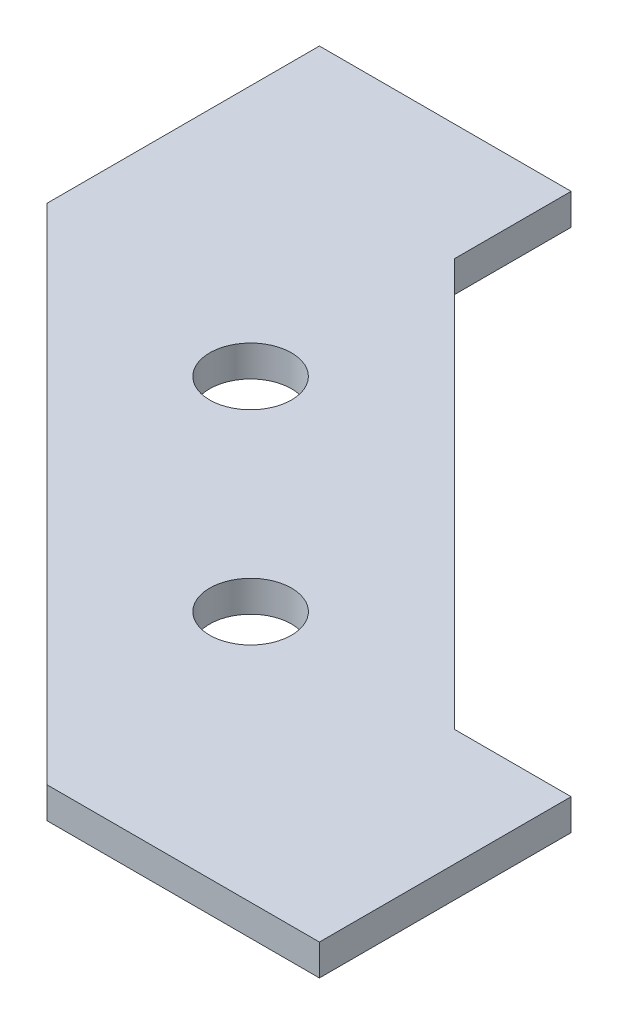
from build123d import *

# Parameters (mm, degrees)
SKETCH_1_R             = 5.25
SM_BASE_FLANGE_1_DEPTH = 4


# Sheet-metal steps are written as plain solids
with BuildPart() as part:
    # Sketch 1 → Базовая кромка1 (new body)
    with BuildSketch(Plane(origin=(0, 0, 0), x_dir=(1, 0, 0), z_dir=(0, 1, 0))):
        Polygon((39.244426356, -13.081475452), (-13.081475452, 39.244426356), (-13.081475452, 54.244426356), (-45.40737726, 54.244426356), (-45.40737726, 19.244426356), (19.244426356, -45.40737726), (54.244426356, -45.40737726), (54.244426356, -13.081475452), align=None)
        with Locations(Location((-13.081475452, 13.081475452, 0), (0, 0, 270))):
            Circle(SKETCH_1_R, mode=Mode.SUBTRACT)
        with Locations(Location((13.081475452, -13.081475452, 0), (0, 0, 90))):
            Circle(SKETCH_1_R, mode=Mode.SUBTRACT)
    extrude(amount=-SM_BASE_FLANGE_1_DEPTH)


solid = part.part
